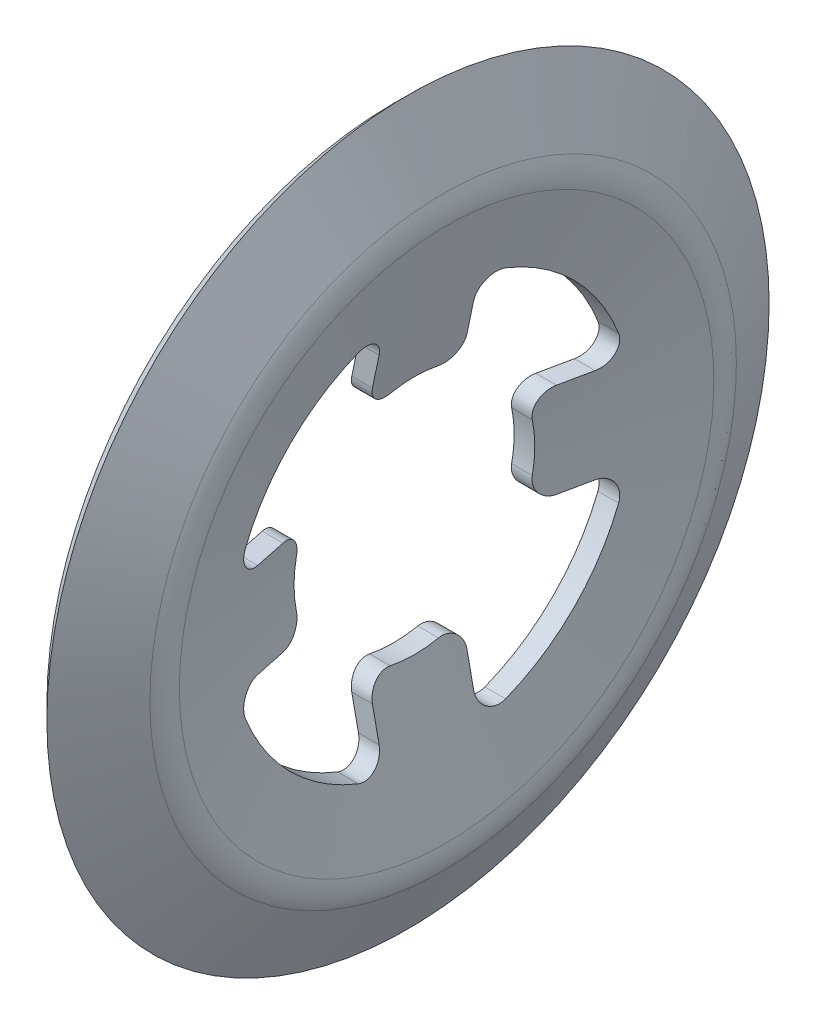
from build123d import *

# Parameters (mm, degrees)
CUT_EXTRUDE2_DEPTH       = 7.745254435
FILLET2_R                = 0.254
CIRPATTERN3_COUNT        = 4
FILLET2_OF_CIRPATTERN3_R = 0.254
FILLET3_R                = 0.508


with BuildPart() as part:
    # Sketch4 → Revolve1 (revolve)
    with BuildSketch(Plane.XY):
        Polygon((-0.3683, 4.57405556), (-0.17985556, 4.7625), (0.3683, 3.704166667), (-0.1143, 1.501593337), (-0.1143, 0), (-0.3683, 0), (-0.3683, 1.5875), (0.091545741, 3.686223507), align=None)
    revolve(axis=Axis((-0.3683, 0, 0), (1, 0, 0)))

    # Sketch7 → Cut-Extrude2 (cut, symmetric)
    with BuildSketch(Plane(origin=(0, 0, 0), x_dir=(0, 0, -1), z_dir=(1, 0, 0))):
        with BuildLine():
            Line((-1.870886692, 1.870886692), (0, 0))
            Line((0, 0), (1.870886692, 1.870886692))
            ThreePointArc((1.870886692, 1.870886692), (1.295489266, 2.30697672), (0.623628897, 2.571287815))
            Line((0.623628897, 2.571287815), (0.623628897, 1.45987782))
            ThreePointArc((0.623628897, 1.45987782), (0, 1.5875), (-0.623628897, 1.45987782))
            Line((-0.623628897, 1.45987782), (-0.623628897, 2.571287815))
            ThreePointArc((-0.623628897, 2.571287815), (-1.295489266, 2.30697672), (-1.870886692, 1.870886692))
        make_face()
    cut_extrude2 = extrude(amount=CUT_EXTRUDE2_DEPTH, both=True, mode=Mode.SUBTRACT)

    # Fillet2
    fillet2_edges = [part.edges().sort_by_distance(p)[0] for p in [
        (0, 2.571287815, 0.623628897),
        (-0.23188861, 1.45987782, 0.623628897),
        (-0.23188861, 1.45987782, -0.623628897),
        (0, 2.571287815, -0.623628897),
    ]]
    fillet(fillet2_edges, radius=FILLET2_R)

    # CirPattern3: Cut-Extrude2 ×4 about axis
    cirpattern3_axis = Axis((-0.3683, 0, 0), (1, 0, 0))
    for i in range(1, CIRPATTERN3_COUNT):
        add(cut_extrude2.rotate(cirpattern3_axis, i * 360 / CIRPATTERN3_COUNT), mode=Mode.SUBTRACT)

    # Fillet2 of CirPattern3
    fillet2_of_cirpattern3_edges = [part.edges().sort_by_distance(p)[0] for p in [
        (0, -0.623628897, 2.571287815),
        (-0.23188861, -0.623628897, 1.45987782),
        (-0.23188861, 0.623628897, 1.45987782),
        (0, 0.623628897, 2.571287815),
        (0, -2.571287815, -0.623628897),
        (-0.23188861, -1.45987782, -0.623628897),
        (-0.23188861, -1.45987782, 0.623628897),
        (0, -2.571287815, 0.623628897),
        (0, 0.623628897, -2.571287815),
        (-0.23188861, 0.623628897, -1.45987782),
        (-0.23188861, -0.623628897, -1.45987782),
        (0, -0.623628897, -2.571287815),
    ]]
    fillet(fillet2_of_cirpattern3_edges, radius=FILLET2_OF_CIRPATTERN3_R)

    # Fillet3
    fillet3_edges = [part.edges().sort_by_distance(p)[0] for p in [
        (0.3683, -3.704166667, 0),
        (0.091545741, -3.686223507, 0),
    ]]
    fillet(fillet3_edges, radius=FILLET3_R)


solid = part.part
